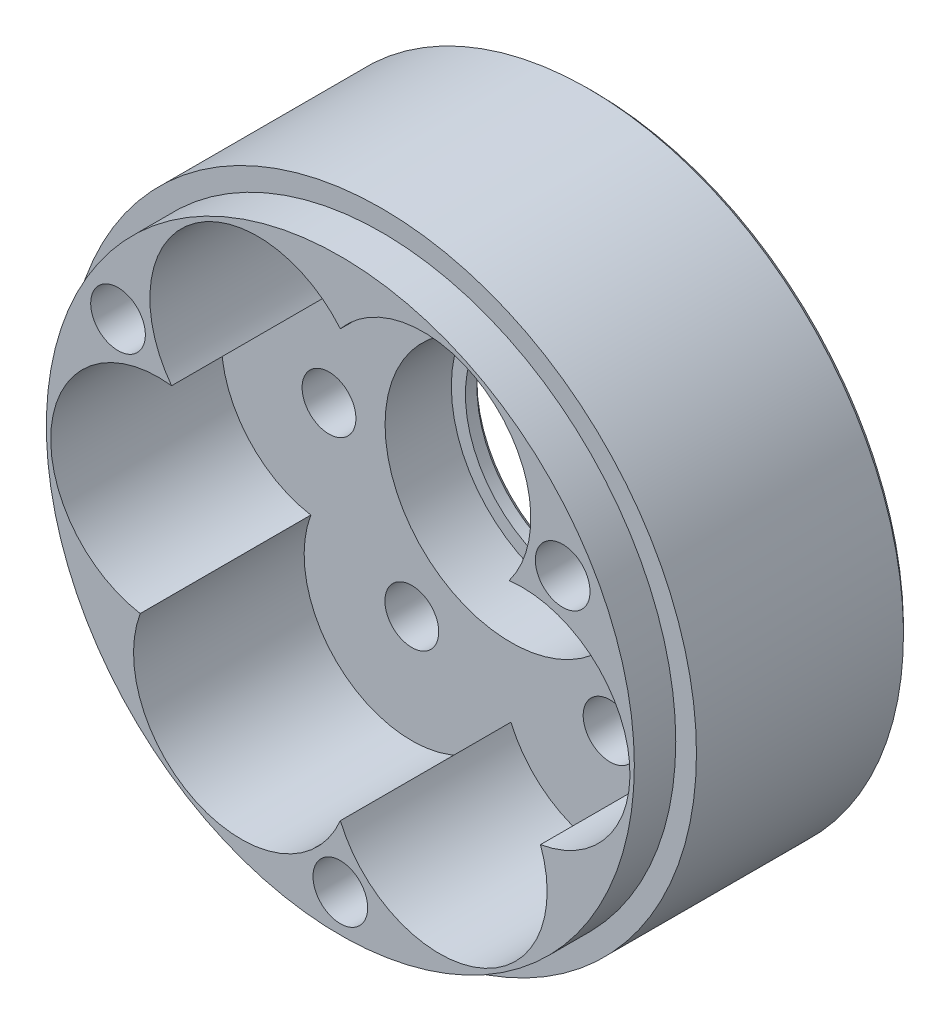
from build123d import *

# Parameters (mm, degrees)
BOSS_EXTRUDE1_OUTLINE_R   = 19
BOSS_EXTRUDE1_OUTLINE_R_2 = 1.65
BOSS_EXTRUDE1_DEPTH       = 10.8
BOSS_EXTRUDE2_START       = -5
SKETCH1_3_R               = 19
SKETCH1_3_R_2             = 1.625
SKETCH1_3_R_3             = 7.6
SKETCH1_3_R_4             = 1.65
BOSS_EXTRUDE2_DEPTH       = 5
BOSS_EXTRUDE3_START       = -5
SKETCH1_4_R               = 1.625
BOSS_EXTRUDE3_DEPTH       = 2
BOSS_EXTRUDE4_START       = -5
SKETCH1_5_R               = 7.6
SKETCH1_5_R_2             = 6.75
BOSS_EXTRUDE4_DEPTH       = 1
CUT_EXTRUDE9_START        = 7.8
SKETCH1_11_R              = 19
SKETCH1_11_R_2            = 18
SKETCH1_11_R_3            = 17.75
CUT_EXTRUDE9_DEPTH        = 3
CUT_EXTRUDE6_DEPTH        = 3.5
CUT_EXTRUDE10_START       = -0.5
SKETCH2_R                 = 17.75
CUT_EXTRUDE10_DEPTH       = 0.5
CHAMFER1_SIZE             = 0.3
CHAMFER2_SIZE             = 0.3
CUT_EXTRUDE12_START       = -3.4
SKETCH1_13_R              = 1.625
CUT_EXTRUDE12_DEPTH       = 0.4


# Read off the part's stored shape, not the designer's step: Boss-Extrude1
with BuildPart() as part:
    # Boss-Extrude1 outline → Boss-Extrude1 (new body)
    with BuildSketch(Plane.XY):
        Circle(BOSS_EXTRUDE1_OUTLINE_R)
        with Locations((0, -15.5)):
            Circle(BOSS_EXTRUDE1_OUTLINE_R_2, mode=Mode.SUBTRACT)
        with Locations((-13.423393759, 7.75)):
            Circle(BOSS_EXTRUDE1_OUTLINE_R_2, mode=Mode.SUBTRACT)
        with BuildLine():
            ThreePointArc((0, -11.764142376), (-8.38018489, -15.2718242), (-12.082155017, -6.975635451))
            ThreePointArc((-12.082155017, -6.975635451), (-17.415880165, 0.378459097), (-10.188046152, 5.882071188))
            ThreePointArc((-10.188046152, 5.882071188), (-9.035695274, 14.893365103), (0, 13.951270903))
            ThreePointArc((0, 13.951270903), (9.035695274, 14.893365103), (10.188046152, 5.882071188))
            ThreePointArc((10.188046152, 5.882071188), (17.415880165, 0.378459097), (12.082155017, -6.975635451))
            ThreePointArc((12.082155017, -6.975635451), (8.38018489, -15.2718242), (0, -11.764142376))
        make_face(mode=Mode.SUBTRACT)
        with Locations((13.423393759, 7.75)):
            Circle(BOSS_EXTRUDE1_OUTLINE_R_2, mode=Mode.SUBTRACT)
    extrude(amount=BOSS_EXTRUDE1_DEPTH)

    # Sketch1<3> → Boss-Extrude2 (add)
    with BuildSketch(Plane.XY.offset(BOSS_EXTRUDE2_START)):
        with Locations(Location((0, 0, 0), (0, 0, 180))):
            Circle(SKETCH1_3_R)
        with Locations((-10.985281374, -0.568852467)):
            Circle(SKETCH1_3_R_2, mode=Mode.SUBTRACT)
        with Locations((-5.985281374, -9.229106504)):
            Circle(SKETCH1_3_R_2, mode=Mode.SUBTRACT)
        with Locations((5.985281374, -9.229106504)):
            Circle(SKETCH1_3_R_2, mode=Mode.SUBTRACT)
        with Locations((10.985281374, -0.568852467)):
            Circle(SKETCH1_3_R_2, mode=Mode.SUBTRACT)
        with Locations((5, 9.797958971)):
            Circle(SKETCH1_3_R_2, mode=Mode.SUBTRACT)
        with Locations((-5, 9.797958971)):
            Circle(SKETCH1_3_R_2, mode=Mode.SUBTRACT)
        Circle(SKETCH1_3_R_3, mode=Mode.SUBTRACT)
        with Locations(Location((-13.423393759, 7.75, 0), (0, 0, 180))):
            Circle(SKETCH1_3_R_4, mode=Mode.SUBTRACT)
        with Locations(Location((13.423393759, 7.75, 0), (0, 0, 180))):
            Circle(SKETCH1_3_R_4, mode=Mode.SUBTRACT)
        with Locations(Location((0, -15.5, 0), (0, 0, 180))):
            Circle(SKETCH1_3_R_4, mode=Mode.SUBTRACT)
    extrude(amount=BOSS_EXTRUDE2_DEPTH)

    # Sketch1<4> → Boss-Extrude3 (add)
    with BuildSketch(Plane.XY.offset(BOSS_EXTRUDE3_START)):
        with Locations((-5, 9.797958971)):
            Circle(SKETCH1_4_R)
        with Locations((5, 9.797958971)):
            Circle(SKETCH1_4_R)
        with Locations((10.985281374, -0.568852467)):
            Circle(SKETCH1_4_R)
        with Locations((5.985281374, -9.229106504)):
            Circle(SKETCH1_4_R)
        with Locations((-5.985281374, -9.229106504)):
            Circle(SKETCH1_4_R)
        with Locations((-10.985281374, -0.568852467)):
            Circle(SKETCH1_4_R)
    extrude(amount=BOSS_EXTRUDE3_DEPTH)

    # Sketch1<5> → Boss-Extrude4 (add)
    with BuildSketch(Plane.XY.offset(BOSS_EXTRUDE4_START)):
        Circle(SKETCH1_5_R)
        Circle(SKETCH1_5_R_2, mode=Mode.SUBTRACT)
    extrude(amount=BOSS_EXTRUDE4_DEPTH)

    # Sketch1<11> → Cut-Extrude9 (cut)
    # profile 1 of 2: a face of its own
    with BuildSketch(Plane.XY.offset(CUT_EXTRUDE9_START)):
        with Locations(Location((0, 0, 0), (0, 0, 180))):
            Circle(SKETCH1_11_R)
        Circle(SKETCH1_11_R_2, mode=Mode.SUBTRACT)
    # profile 2 of 2: a face of its own
    with BuildSketch(Plane.XY.offset(CUT_EXTRUDE9_START)):
        Circle(SKETCH1_11_R_2)
        Circle(SKETCH1_11_R_3, mode=Mode.SUBTRACT)
    extrude(amount=CUT_EXTRUDE9_DEPTH, mode=Mode.SUBTRACT)

    # Sketch4 → Cut-Extrude6 (cut)
    with BuildSketch(Plane(origin=(0, 0, -5), x_dir=(-1, 0, 0), z_dir=(0, 0, -1))):
        Polygon((11.777945491, 4.9), (15.068842026, 4.9), (16.714290293, 7.75), (15.068842026, 10.6), (11.777945491, 10.6), (10.132497224, 7.75), align=None)
        Polygon((-1.645448267, -12.65), (-3.290896534, -15.5), (-1.645448267, -18.35), (1.645448267, -18.35), (3.290896534, -15.5), (1.645448267, -12.65), align=None)
        Polygon((-11.777945491, 4.9), (-10.132497224, 7.75), (-11.777945491, 10.6), (-15.068842026, 10.6), (-16.714290293, 7.75), (-15.068842026, 4.9), align=None)
    extrude(amount=-CUT_EXTRUDE6_DEPTH, mode=Mode.SUBTRACT)

    # Sketch2 → Cut-Extrude10 (cut)
    with BuildSketch(Plane.XY.offset(10.8).offset(CUT_EXTRUDE10_START)):
        Circle(SKETCH2_R)
    extrude(amount=CUT_EXTRUDE10_DEPTH, mode=Mode.SUBTRACT)

    # Chamfer1
    chamfer1_edges = [part.edges().sort_by_distance(p)[0] for p in [
        (19, 0, -5),
        (-6.75, 0, -5),
    ]]
    chamfer(chamfer1_edges, length=CHAMFER1_SIZE)

    # Chamfer2
    # the kernel refuses this chamfer: 0.3 mm, written as the material it takes off along each edge
    with BuildSketch(Plane(origin=(-9.746744776, 8.418142839, -5), x_dir=(0.8656979742248802, -0.49981095845564855, -0.02749587661058736), z_dir=(-0.5000000000000003, -0.8660254037844386, 0))) as chamfer2_piece_1_section:
        Polygon((CHAMFER2_SIZE * 0.999621916911, CHAMFER2_SIZE * 0.0274958766106), (-CHAMFER2_SIZE * 0.0274958766106, CHAMFER2_SIZE * 0.999621916911), (0, 0), align=None)
    chamfer2_piece_1 = extrude(amount=4.833906327, mode=Mode.PRIVATE)
    chamfer2_piece_1 = split(chamfer2_piece_1, bisect_by=Plane(origin=(-9.679193276, 6.964854531, -4.899951291), z_dir=(-0.8660254037844389, -0.4999999999999996, 0)), keep=Keep.TOP, mode=Mode.PRIVATE)
    chamfer2_piece_1 = split(chamfer2_piece_1, bisect_by=Plane(origin=(-10.871337596, 4.9, -4.899951291), z_dir=(0, 1, 0)), keep=Keep.TOP, mode=Mode.PRIVATE)
    add(chamfer2_piece_1, mode=Mode.SUBTRACT)
    with BuildSketch(Plane(origin=(-11.006440595, 4.9, -5), x_dir=(0, -0.9996219169112968, -0.027495876610587344), z_dir=(-1, 0, 0))) as chamfer2_piece_2_section:
        Polygon((CHAMFER2_SIZE * 0.999621916911, CHAMFER2_SIZE * 0.0274958766106), (-CHAMFER2_SIZE * 0.0274958766106, CHAMFER2_SIZE * 0.999621916911), (0, 0), align=None)
    chamfer2_piece_2 = extrude(amount=4.833906327, mode=Mode.PRIVATE)
    chamfer2_piece_2 = split(chamfer2_piece_2, bisect_by=Plane(origin=(-12.231249439, 4.114854531, -4.899951291), z_dir=(-0.8660254037844387, 0.5000000000000003, 0)), keep=Keep.TOP, mode=Mode.PRIVATE)
    chamfer2_piece_2 = split(chamfer2_piece_2, bisect_by=Plane(origin=(-14.615538078, 4.114854531, -4.899951291), z_dir=(0.8660254037844396, 0.4999999999999984, 0)), keep=Keep.TOP, mode=Mode.PRIVATE)
    add(chamfer2_piece_2, mode=Mode.SUBTRACT)
    with BuildSketch(Plane(origin=(-14.683089578, 4.231857161, -5), x_dir=(-0.8656979742248813, -0.49981095845564677, -0.027495876610587403), z_dir=(-0.4999999999999984, 0.8660254037844396, 0))) as chamfer2_piece_3_section:
        Polygon((CHAMFER2_SIZE * 0.999621916911, CHAMFER2_SIZE * 0.0274958766106), (-CHAMFER2_SIZE * 0.0274958766106, CHAMFER2_SIZE * 0.999621916911), (0, 0), align=None)
    chamfer2_piece_3 = extrude(amount=4.833906327, mode=Mode.PRIVATE)
    chamfer2_piece_3 = split(chamfer2_piece_3, bisect_by=Plane(origin=(-17.167594241, 6.964854531, -4.899951291), z_dir=(0.8660254037844386, -0.5000000000000001, 0)), keep=Keep.TOP, mode=Mode.PRIVATE)
    chamfer2_piece_3 = split(chamfer2_piece_3, bisect_by=Plane(origin=(-15.975449921, 4.9, -4.899951291), z_dir=(0, 1, 0)), keep=Keep.TOP, mode=Mode.PRIVATE)
    add(chamfer2_piece_3, mode=Mode.SUBTRACT)
    with BuildSketch(Plane(origin=(-17.100042741, 7.081857161, -5), x_dir=(-0.8656979742248804, 0.4998109584556485, -0.027495876610587368), z_dir=(0.5000000000000001, 0.8660254037844386, 0))) as chamfer2_piece_4_section:
        Polygon((CHAMFER2_SIZE * 0.999621916911, CHAMFER2_SIZE * 0.0274958766106), (-CHAMFER2_SIZE * 0.0274958766106, CHAMFER2_SIZE * 0.999621916911), (0, 0), align=None)
    chamfer2_piece_4 = extrude(amount=4.833906327, mode=Mode.PRIVATE)
    chamfer2_piece_4 = split(chamfer2_piece_4, bisect_by=Plane(origin=(-15.975449921, 10.6, -4.899951291), z_dir=(0, -1, 0)), keep=Keep.TOP, mode=Mode.PRIVATE)
    chamfer2_piece_4 = split(chamfer2_piece_4, bisect_by=Plane(origin=(-17.167594241, 8.535145469, -4.899951291), z_dir=(0.8660254037844396, 0.4999999999999984, 0)), keep=Keep.TOP, mode=Mode.PRIVATE)
    add(chamfer2_piece_4, mode=Mode.SUBTRACT)
    with BuildSketch(Plane(origin=(-15.840346922, 10.6, -5), x_dir=(0, 0.9996219169112968, -0.027495876610587344), z_dir=(1, 0, 0))) as chamfer2_piece_5_section:
        Polygon((CHAMFER2_SIZE * 0.999621916911, CHAMFER2_SIZE * 0.0274958766106), (-CHAMFER2_SIZE * 0.0274958766106, CHAMFER2_SIZE * 0.999621916911), (0, 0), align=None)
    chamfer2_piece_5 = extrude(amount=4.833906327, mode=Mode.PRIVATE)
    chamfer2_piece_5 = split(chamfer2_piece_5, bisect_by=Plane(origin=(-12.231249439, 11.385145469, -4.899951291), z_dir=(-0.8660254037844389, -0.4999999999999996, 0)), keep=Keep.TOP, mode=Mode.PRIVATE)
    chamfer2_piece_5 = split(chamfer2_piece_5, bisect_by=Plane(origin=(-14.615538078, 11.385145469, -4.899951291), z_dir=(0.8660254037844386, -0.5000000000000001, 0)), keep=Keep.TOP, mode=Mode.PRIVATE)
    add(chamfer2_piece_5, mode=Mode.SUBTRACT)
    with BuildSketch(Plane(origin=(-12.16369794, 11.268142839, -5), x_dir=(0.8656979742248805, 0.4998109584556478, -0.02749587661058736), z_dir=(0.4999999999999996, -0.8660254037844389, 0))) as chamfer2_piece_6_section:
        Polygon((CHAMFER2_SIZE * 0.999621916911, CHAMFER2_SIZE * 0.0274958766106), (-CHAMFER2_SIZE * 0.0274958766106, CHAMFER2_SIZE * 0.999621916911), (0, 0), align=None)
    chamfer2_piece_6 = extrude(amount=4.833906327, mode=Mode.PRIVATE)
    chamfer2_piece_6 = split(chamfer2_piece_6, bisect_by=Plane(origin=(-9.679193276, 8.535145469, -4.899951291), z_dir=(-0.8660254037844387, 0.5000000000000003, 0)), keep=Keep.TOP, mode=Mode.PRIVATE)
    chamfer2_piece_6 = split(chamfer2_piece_6, bisect_by=Plane(origin=(-10.871337596, 10.6, -4.899951291), z_dir=(0, -1, 0)), keep=Keep.TOP, mode=Mode.PRIVATE)
    add(chamfer2_piece_6, mode=Mode.SUBTRACT)
    with BuildSketch(Plane(origin=(-2.416953164, -12.65, -5), x_dir=(0, 0.9996219169112968, -0.027495876610587344), z_dir=(1, 0, 0))) as chamfer2_piece_7_section:
        Polygon((CHAMFER2_SIZE * 0.999621916911, CHAMFER2_SIZE * 0.0274958766106), (-CHAMFER2_SIZE * 0.0274958766106, CHAMFER2_SIZE * 0.999621916911), (0, 0), align=None)
    chamfer2_piece_7 = extrude(amount=4.833906327, mode=Mode.PRIVATE)
    chamfer2_piece_7 = split(chamfer2_piece_7, bisect_by=Plane(origin=(-1.192144319, -11.864854531, -4.899951291), z_dir=(0.8660254037844389, -0.4999999999999995, 0)), keep=Keep.TOP, mode=Mode.PRIVATE)
    chamfer2_piece_7 = split(chamfer2_piece_7, bisect_by=Plane(origin=(1.192144319, -11.864854531, -4.899951291), z_dir=(-0.8660254037844385, -0.5000000000000003, 0)), keep=Keep.TOP, mode=Mode.PRIVATE)
    add(chamfer2_piece_7, mode=Mode.SUBTRACT)
    with BuildSketch(Plane(origin=(1.259695819, -11.981857161, -5), x_dir=(0.8656979742248802, 0.4998109584556487, -0.027495876610587368), z_dir=(0.5000000000000003, -0.8660254037844385, 0))) as chamfer2_piece_8_section:
        Polygon((CHAMFER2_SIZE * 0.999621916911, CHAMFER2_SIZE * 0.0274958766106), (-CHAMFER2_SIZE * 0.0274958766106, CHAMFER2_SIZE * 0.999621916911), (0, 0), align=None)
    chamfer2_piece_8 = extrude(amount=4.833906327, mode=Mode.PRIVATE)
    chamfer2_piece_8 = split(chamfer2_piece_8, bisect_by=Plane(origin=(2.552056163, -12.65, -4.899951291), z_dir=(0, -1, 0)), keep=Keep.TOP, mode=Mode.PRIVATE)
    chamfer2_piece_8 = split(chamfer2_piece_8, bisect_by=Plane(origin=(3.744200482, -14.714854531, -4.899951291), z_dir=(-0.8660254037844387, 0.5000000000000003, 0)), keep=Keep.TOP, mode=Mode.PRIVATE)
    add(chamfer2_piece_8, mode=Mode.SUBTRACT)
    with BuildSketch(Plane(origin=(3.676648983, -14.831857161, -5), x_dir=(0.8656979742248802, -0.49981095845564855, -0.02749587661058736), z_dir=(-0.5000000000000003, -0.8660254037844386, 0))) as chamfer2_piece_9_section:
        Polygon((CHAMFER2_SIZE * 0.999621916911, CHAMFER2_SIZE * 0.0274958766106), (-CHAMFER2_SIZE * 0.0274958766106, CHAMFER2_SIZE * 0.999621916911), (0, 0), align=None)
    chamfer2_piece_9 = extrude(amount=4.833906327, mode=Mode.PRIVATE)
    chamfer2_piece_9 = split(chamfer2_piece_9, bisect_by=Plane(origin=(2.552056163, -18.35, -4.899951291), z_dir=(0, 1, 0)), keep=Keep.TOP, mode=Mode.PRIVATE)
    chamfer2_piece_9 = split(chamfer2_piece_9, bisect_by=Plane(origin=(3.744200482, -16.285145469, -4.899951291), z_dir=(-0.8660254037844385, -0.5000000000000003, 0)), keep=Keep.TOP, mode=Mode.PRIVATE)
    add(chamfer2_piece_9, mode=Mode.SUBTRACT)
    with BuildSketch(Plane(origin=(2.416953164, -18.35, -5), x_dir=(0, -0.9996219169112968, -0.027495876610587344), z_dir=(-1, 0, 0))) as chamfer2_piece_10_section:
        Polygon((CHAMFER2_SIZE * 0.999621916911, CHAMFER2_SIZE * 0.0274958766106), (-CHAMFER2_SIZE * 0.0274958766106, CHAMFER2_SIZE * 0.999621916911), (0, 0), align=None)
    chamfer2_piece_10 = extrude(amount=4.833906327, mode=Mode.PRIVATE)
    chamfer2_piece_10 = split(chamfer2_piece_10, bisect_by=Plane(origin=(-1.192144319, -19.135145469, -4.899951291), z_dir=(0.8660254037844385, 0.5000000000000004, 0)), keep=Keep.TOP, mode=Mode.PRIVATE)
    chamfer2_piece_10 = split(chamfer2_piece_10, bisect_by=Plane(origin=(1.192144319, -19.135145469, -4.899951291), z_dir=(-0.8660254037844387, 0.5000000000000003, 0)), keep=Keep.TOP, mode=Mode.PRIVATE)
    add(chamfer2_piece_10, mode=Mode.SUBTRACT)
    with BuildSketch(Plane(origin=(-1.259695819, -19.018142839, -5), x_dir=(-0.86569797422488, -0.4998109584556487, -0.027495876610587347), z_dir=(-0.5000000000000004, 0.8660254037844385, 0))) as chamfer2_piece_11_section:
        Polygon((CHAMFER2_SIZE * 0.999621916911, CHAMFER2_SIZE * 0.0274958766106), (-CHAMFER2_SIZE * 0.0274958766106, CHAMFER2_SIZE * 0.999621916911), (0, 0), align=None)
    chamfer2_piece_11 = extrude(amount=4.833906327, mode=Mode.PRIVATE)
    chamfer2_piece_11 = split(chamfer2_piece_11, bisect_by=Plane(origin=(-3.744200482, -16.285145469, -4.899951291), z_dir=(0.8660254037844389, -0.4999999999999995, 0)), keep=Keep.TOP, mode=Mode.PRIVATE)
    chamfer2_piece_11 = split(chamfer2_piece_11, bisect_by=Plane(origin=(-2.552056163, -18.35, -4.899951291), z_dir=(0, 1, 0)), keep=Keep.TOP, mode=Mode.PRIVATE)
    add(chamfer2_piece_11, mode=Mode.SUBTRACT)
    with BuildSketch(Plane(origin=(-3.676648983, -16.168142839, -5), x_dir=(-0.8656979742248805, 0.4998109584556478, -0.02749587661058736), z_dir=(0.4999999999999995, 0.8660254037844389, 0))) as chamfer2_piece_12_section:
        Polygon((CHAMFER2_SIZE * 0.999621916911, CHAMFER2_SIZE * 0.0274958766106), (-CHAMFER2_SIZE * 0.0274958766106, CHAMFER2_SIZE * 0.999621916911), (0, 0), align=None)
    chamfer2_piece_12 = extrude(amount=4.833906327, mode=Mode.PRIVATE)
    chamfer2_piece_12 = split(chamfer2_piece_12, bisect_by=Plane(origin=(-2.552056163, -12.65, -4.899951291), z_dir=(0, -1, 0)), keep=Keep.TOP, mode=Mode.PRIVATE)
    chamfer2_piece_12 = split(chamfer2_piece_12, bisect_by=Plane(origin=(-3.744200482, -14.714854531, -4.899951291), z_dir=(0.8660254037844385, 0.5000000000000004, 0)), keep=Keep.TOP, mode=Mode.PRIVATE)
    add(chamfer2_piece_12, mode=Mode.SUBTRACT)
    with BuildSketch(Plane(origin=(15.840346922, 4.9, -5), x_dir=(0, -0.9996219169112968, -0.027495876610587344), z_dir=(-1, 0, 0))) as chamfer2_piece_13_section:
        Polygon((CHAMFER2_SIZE * 0.999621916911, CHAMFER2_SIZE * 0.0274958766106), (-CHAMFER2_SIZE * 0.0274958766106, CHAMFER2_SIZE * 0.999621916911), (0, 0), align=None)
    chamfer2_piece_13 = extrude(amount=4.833906327, mode=Mode.PRIVATE)
    chamfer2_piece_13 = split(chamfer2_piece_13, bisect_by=Plane(origin=(14.615538078, 4.114854531, -4.899951291), z_dir=(-0.8660254037844389, 0.4999999999999995, 0)), keep=Keep.TOP, mode=Mode.PRIVATE)
    chamfer2_piece_13 = split(chamfer2_piece_13, bisect_by=Plane(origin=(12.231249439, 4.114854531, -4.899951291), z_dir=(0.8660254037844386, 0.5000000000000001, 0)), keep=Keep.TOP, mode=Mode.PRIVATE)
    add(chamfer2_piece_13, mode=Mode.SUBTRACT)
    with BuildSketch(Plane(origin=(12.16369794, 4.231857161, -5), x_dir=(-0.8656979742248804, -0.4998109584556485, -0.027495876610587368), z_dir=(-0.5000000000000001, 0.8660254037844386, 0))) as chamfer2_piece_14_section:
        Polygon((CHAMFER2_SIZE * 0.999621916911, CHAMFER2_SIZE * 0.0274958766106), (-CHAMFER2_SIZE * 0.0274958766106, CHAMFER2_SIZE * 0.999621916911), (0, 0), align=None)
    chamfer2_piece_14 = extrude(amount=4.833906327, mode=Mode.PRIVATE)
    chamfer2_piece_14 = split(chamfer2_piece_14, bisect_by=Plane(origin=(10.871337596, 4.9, -4.899951291), z_dir=(0, 1, 0)), keep=Keep.TOP, mode=Mode.PRIVATE)
    chamfer2_piece_14 = split(chamfer2_piece_14, bisect_by=Plane(origin=(9.679193276, 6.964854531, -4.899951291), z_dir=(0.8660254037844388, -0.49999999999999967, 0)), keep=Keep.TOP, mode=Mode.PRIVATE)
    add(chamfer2_piece_14, mode=Mode.SUBTRACT)
    with BuildSketch(Plane(origin=(9.746744776, 7.081857161, -5), x_dir=(-0.8656979742248805, 0.4998109584556481, -0.027495876610587406), z_dir=(0.49999999999999967, 0.8660254037844388, 0))) as chamfer2_piece_15_section:
        Polygon((CHAMFER2_SIZE * 0.999621916911, CHAMFER2_SIZE * 0.0274958766106), (-CHAMFER2_SIZE * 0.0274958766106, CHAMFER2_SIZE * 0.999621916911), (0, 0), align=None)
    chamfer2_piece_15 = extrude(amount=4.833906327, mode=Mode.PRIVATE)
    chamfer2_piece_15 = split(chamfer2_piece_15, bisect_by=Plane(origin=(10.871337596, 10.6, -4.899951291), z_dir=(0, -1, 0)), keep=Keep.TOP, mode=Mode.PRIVATE)
    chamfer2_piece_15 = split(chamfer2_piece_15, bisect_by=Plane(origin=(9.679193276, 8.535145469, -4.899951291), z_dir=(0.8660254037844386, 0.5000000000000001, 0)), keep=Keep.TOP, mode=Mode.PRIVATE)
    add(chamfer2_piece_15, mode=Mode.SUBTRACT)
    with BuildSketch(Plane(origin=(11.006440595, 10.6, -5), x_dir=(0, 0.9996219169112968, -0.027495876610587344), z_dir=(1, 0, 0))) as chamfer2_piece_16_section:
        Polygon((CHAMFER2_SIZE * 0.999621916911, CHAMFER2_SIZE * 0.0274958766106), (-CHAMFER2_SIZE * 0.0274958766106, CHAMFER2_SIZE * 0.999621916911), (0, 0), align=None)
    chamfer2_piece_16 = extrude(amount=4.833906327, mode=Mode.PRIVATE)
    chamfer2_piece_16 = split(chamfer2_piece_16, bisect_by=Plane(origin=(14.615538078, 11.385145469, -4.899951291), z_dir=(-0.8660254037844388, -0.4999999999999999, 0)), keep=Keep.TOP, mode=Mode.PRIVATE)
    chamfer2_piece_16 = split(chamfer2_piece_16, bisect_by=Plane(origin=(12.231249439, 11.385145469, -4.899951291), z_dir=(0.8660254037844388, -0.49999999999999967, 0)), keep=Keep.TOP, mode=Mode.PRIVATE)
    add(chamfer2_piece_16, mode=Mode.SUBTRACT)
    with BuildSketch(Plane(origin=(14.683089578, 11.268142839, -5), x_dir=(0.8656979742248804, 0.4998109584556482, -0.02749587661058736), z_dir=(0.4999999999999999, -0.8660254037844388, 0))) as chamfer2_piece_17_section:
        Polygon((CHAMFER2_SIZE * 0.999621916911, CHAMFER2_SIZE * 0.0274958766106), (-CHAMFER2_SIZE * 0.0274958766106, CHAMFER2_SIZE * 0.999621916911), (0, 0), align=None)
    chamfer2_piece_17 = extrude(amount=4.833906327, mode=Mode.PRIVATE)
    chamfer2_piece_17 = split(chamfer2_piece_17, bisect_by=Plane(origin=(17.167594241, 8.535145469, -4.899951291), z_dir=(-0.8660254037844389, 0.4999999999999995, 0)), keep=Keep.TOP, mode=Mode.PRIVATE)
    chamfer2_piece_17 = split(chamfer2_piece_17, bisect_by=Plane(origin=(15.975449921, 10.6, -4.899951291), z_dir=(0, -1, 0)), keep=Keep.TOP, mode=Mode.PRIVATE)
    add(chamfer2_piece_17, mode=Mode.SUBTRACT)
    with BuildSketch(Plane(origin=(17.100042741, 8.418142839, -5), x_dir=(0.8656979742248805, -0.4998109584556478, -0.02749587661058736), z_dir=(-0.4999999999999995, -0.8660254037844389, 0))) as chamfer2_piece_18_section:
        Polygon((CHAMFER2_SIZE * 0.999621916911, CHAMFER2_SIZE * 0.0274958766106), (-CHAMFER2_SIZE * 0.0274958766106, CHAMFER2_SIZE * 0.999621916911), (0, 0), align=None)
    chamfer2_piece_18 = extrude(amount=4.833906327, mode=Mode.PRIVATE)
    chamfer2_piece_18 = split(chamfer2_piece_18, bisect_by=Plane(origin=(15.975449921, 4.9, -4.899951291), z_dir=(0, 1, 0)), keep=Keep.TOP, mode=Mode.PRIVATE)
    chamfer2_piece_18 = split(chamfer2_piece_18, bisect_by=Plane(origin=(17.167594241, 6.964854531, -4.899951291), z_dir=(-0.8660254037844388, -0.4999999999999999, 0)), keep=Keep.TOP, mode=Mode.PRIVATE)
    add(chamfer2_piece_18, mode=Mode.SUBTRACT)
    with BuildSketch(Plane(origin=(-9.746744776, 8.418142839, -5), x_dir=(0.8656979742248802, -0.49981095845564855, -0.02749587661058736), z_dir=(-0.5000000000000003, -0.8660254037844386, 0))) as chamfer2_piece_19a_section:
        Polygon((CHAMFER2_SIZE * 0.999621916911, CHAMFER2_SIZE * 0.0274958766106), (-CHAMFER2_SIZE * 0.0274958766106, CHAMFER2_SIZE * 0.999621916911), (0, 0), align=None)
    chamfer2_piece_19a = extrude(amount=4.833906327, mode=Mode.PRIVATE)
    chamfer2_piece_19a = split(chamfer2_piece_19a, bisect_by=Plane(origin=(-10.176941954, 7.82698053, -4.903190769), z_dir=(0.8660254037844389, 0.4999999999999996, 0)), keep=Keep.TOP, mode=Mode.PRIVATE)
    with BuildSketch(Plane(origin=(-12.16369794, 11.268142839, -5), x_dir=(0.8656979742248805, 0.4998109584556478, -0.02749587661058736), z_dir=(0.4999999999999996, -0.8660254037844389, 0))) as chamfer2_piece_19b_section:
        Polygon((CHAMFER2_SIZE * 0.999621916911, CHAMFER2_SIZE * 0.0274958766106), (-CHAMFER2_SIZE * 0.0274958766106, CHAMFER2_SIZE * 0.999621916911), (0, 0), align=None)
    chamfer2_piece_19b = extrude(amount=4.833906327, mode=Mode.PRIVATE)
    chamfer2_piece_19b = split(chamfer2_piece_19b, bisect_by=Plane(origin=(-10.176941954, 7.67301947, -4.903190769), z_dir=(0.8660254037844387, -0.5000000000000003, 0)), keep=Keep.TOP, mode=Mode.PRIVATE)
    chamfer2_piece_19 = chamfer2_piece_19a & chamfer2_piece_19b
    add(chamfer2_piece_19, mode=Mode.SUBTRACT)
    with BuildSketch(Plane(origin=(-9.746744776, 8.418142839, -5), x_dir=(0.8656979742248802, -0.49981095845564855, -0.02749587661058736), z_dir=(-0.5000000000000003, -0.8660254037844386, 0))) as chamfer2_piece_20a_section:
        Polygon((CHAMFER2_SIZE * 0.999621916911, CHAMFER2_SIZE * 0.0274958766106), (-CHAMFER2_SIZE * 0.0274958766106, CHAMFER2_SIZE * 0.999621916911), (0, 0), align=None)
    chamfer2_piece_20a = extrude(amount=4.833906327, mode=Mode.PRIVATE)
    chamfer2_piece_20a = split(chamfer2_piece_20a, bisect_by=Plane(origin=(-11.866834951, 4.9, -4.903190769), z_dir=(0, -1, 0)), keep=Keep.TOP, mode=Mode.PRIVATE)
    with BuildSketch(Plane(origin=(-11.006440595, 4.9, -5), x_dir=(0, -0.9996219169112968, -0.027495876610587344), z_dir=(-1, 0, 0))) as chamfer2_piece_20b_section:
        Polygon((CHAMFER2_SIZE * 0.999621916911, CHAMFER2_SIZE * 0.0274958766106), (-CHAMFER2_SIZE * 0.0274958766106, CHAMFER2_SIZE * 0.999621916911), (0, 0), align=None)
    chamfer2_piece_20b = extrude(amount=4.833906327, mode=Mode.PRIVATE)
    chamfer2_piece_20b = split(chamfer2_piece_20b, bisect_by=Plane(origin=(-11.733500761, 4.97698053, -4.903190769), z_dir=(0.8660254037844387, -0.5000000000000003, 0)), keep=Keep.TOP, mode=Mode.PRIVATE)
    chamfer2_piece_20 = chamfer2_piece_20a & chamfer2_piece_20b
    add(chamfer2_piece_20, mode=Mode.SUBTRACT)
    with BuildSketch(Plane(origin=(-14.683089578, 4.231857161, -5), x_dir=(-0.8656979742248813, -0.49981095845564677, -0.027495876610587403), z_dir=(-0.4999999999999984, 0.8660254037844396, 0))) as chamfer2_piece_21a_section:
        Polygon((CHAMFER2_SIZE * 0.999621916911, CHAMFER2_SIZE * 0.0274958766106), (-CHAMFER2_SIZE * 0.0274958766106, CHAMFER2_SIZE * 0.999621916911), (0, 0), align=None)
    chamfer2_piece_21a = extrude(amount=4.833906327, mode=Mode.PRIVATE)
    chamfer2_piece_21a = split(chamfer2_piece_21a, bisect_by=Plane(origin=(-14.979952566, 4.9, -4.903190769), z_dir=(0, -1, 0)), keep=Keep.TOP, mode=Mode.PRIVATE)
    with BuildSketch(Plane(origin=(-11.006440595, 4.9, -5), x_dir=(0, -0.9996219169112968, -0.027495876610587344), z_dir=(-1, 0, 0))) as chamfer2_piece_21b_section:
        Polygon((CHAMFER2_SIZE * 0.999621916911, CHAMFER2_SIZE * 0.0274958766106), (-CHAMFER2_SIZE * 0.0274958766106, CHAMFER2_SIZE * 0.999621916911), (0, 0), align=None)
    chamfer2_piece_21b = extrude(amount=4.833906327, mode=Mode.PRIVATE)
    chamfer2_piece_21b = split(chamfer2_piece_21b, bisect_by=Plane(origin=(-15.113286756, 4.97698053, -4.903190769), z_dir=(-0.8660254037844396, -0.4999999999999984, 0)), keep=Keep.TOP, mode=Mode.PRIVATE)
    chamfer2_piece_21 = chamfer2_piece_21a & chamfer2_piece_21b
    add(chamfer2_piece_21, mode=Mode.SUBTRACT)
    with BuildSketch(Plane(origin=(-17.100042741, 7.081857161, -5), x_dir=(-0.8656979742248804, 0.4998109584556485, -0.027495876610587368), z_dir=(0.5000000000000001, 0.8660254037844386, 0))) as chamfer2_piece_22a_section:
        Polygon((CHAMFER2_SIZE * 0.999621916911, CHAMFER2_SIZE * 0.0274958766106), (-CHAMFER2_SIZE * 0.0274958766106, CHAMFER2_SIZE * 0.999621916911), (0, 0), align=None)
    chamfer2_piece_22a = extrude(amount=4.833906327, mode=Mode.PRIVATE)
    chamfer2_piece_22a = split(chamfer2_piece_22a, bisect_by=Plane(origin=(-16.669845563, 7.67301947, -4.903190769), z_dir=(-0.8660254037844396, -0.4999999999999984, 0)), keep=Keep.TOP, mode=Mode.PRIVATE)
    with BuildSketch(Plane(origin=(-14.683089578, 4.231857161, -5), x_dir=(-0.8656979742248813, -0.49981095845564677, -0.027495876610587403), z_dir=(-0.4999999999999984, 0.8660254037844396, 0))) as chamfer2_piece_22b_section:
        Polygon((CHAMFER2_SIZE * 0.999621916911, CHAMFER2_SIZE * 0.0274958766106), (-CHAMFER2_SIZE * 0.0274958766106, CHAMFER2_SIZE * 0.999621916911), (0, 0), align=None)
    chamfer2_piece_22b = extrude(amount=4.833906327, mode=Mode.PRIVATE)
    chamfer2_piece_22b = split(chamfer2_piece_22b, bisect_by=Plane(origin=(-16.669845563, 7.82698053, -4.903190769), z_dir=(-0.8660254037844386, 0.5000000000000001, 0)), keep=Keep.TOP, mode=Mode.PRIVATE)
    chamfer2_piece_22 = chamfer2_piece_22a & chamfer2_piece_22b
    add(chamfer2_piece_22, mode=Mode.SUBTRACT)
    with BuildSketch(Plane(origin=(-15.840346922, 10.6, -5), x_dir=(0, 0.9996219169112968, -0.027495876610587344), z_dir=(1, 0, 0))) as chamfer2_piece_23a_section:
        Polygon((CHAMFER2_SIZE * 0.999621916911, CHAMFER2_SIZE * 0.0274958766106), (-CHAMFER2_SIZE * 0.0274958766106, CHAMFER2_SIZE * 0.999621916911), (0, 0), align=None)
    chamfer2_piece_23a = extrude(amount=4.833906327, mode=Mode.PRIVATE)
    chamfer2_piece_23a = split(chamfer2_piece_23a, bisect_by=Plane(origin=(-15.113286756, 10.52301947, -4.903190769), z_dir=(-0.8660254037844386, 0.5000000000000001, 0)), keep=Keep.TOP, mode=Mode.PRIVATE)
    with BuildSketch(Plane(origin=(-17.100042741, 7.081857161, -5), x_dir=(-0.8656979742248804, 0.4998109584556485, -0.027495876610587368), z_dir=(0.5000000000000001, 0.8660254037844386, 0))) as chamfer2_piece_23b_section:
        Polygon((CHAMFER2_SIZE * 0.999621916911, CHAMFER2_SIZE * 0.0274958766106), (-CHAMFER2_SIZE * 0.0274958766106, CHAMFER2_SIZE * 0.999621916911), (0, 0), align=None)
    chamfer2_piece_23b = extrude(amount=4.833906327, mode=Mode.PRIVATE)
    chamfer2_piece_23b = split(chamfer2_piece_23b, bisect_by=Plane(origin=(-14.979952566, 10.6, -4.903190769), z_dir=(0, 1, 0)), keep=Keep.TOP, mode=Mode.PRIVATE)
    chamfer2_piece_23 = chamfer2_piece_23a & chamfer2_piece_23b
    add(chamfer2_piece_23, mode=Mode.SUBTRACT)
    with BuildSketch(Plane(origin=(-12.16369794, 11.268142839, -5), x_dir=(0.8656979742248805, 0.4998109584556478, -0.02749587661058736), z_dir=(0.4999999999999996, -0.8660254037844389, 0))) as chamfer2_piece_24a_section:
        Polygon((CHAMFER2_SIZE * 0.999621916911, CHAMFER2_SIZE * 0.0274958766106), (-CHAMFER2_SIZE * 0.0274958766106, CHAMFER2_SIZE * 0.999621916911), (0, 0), align=None)
    chamfer2_piece_24a = extrude(amount=4.833906327, mode=Mode.PRIVATE)
    chamfer2_piece_24a = split(chamfer2_piece_24a, bisect_by=Plane(origin=(-11.866834951, 10.6, -4.903190769), z_dir=(0, 1, 0)), keep=Keep.TOP, mode=Mode.PRIVATE)
    with BuildSketch(Plane(origin=(-15.840346922, 10.6, -5), x_dir=(0, 0.9996219169112968, -0.027495876610587344), z_dir=(1, 0, 0))) as chamfer2_piece_24b_section:
        Polygon((CHAMFER2_SIZE * 0.999621916911, CHAMFER2_SIZE * 0.0274958766106), (-CHAMFER2_SIZE * 0.0274958766106, CHAMFER2_SIZE * 0.999621916911), (0, 0), align=None)
    chamfer2_piece_24b = extrude(amount=4.833906327, mode=Mode.PRIVATE)
    chamfer2_piece_24b = split(chamfer2_piece_24b, bisect_by=Plane(origin=(-11.733500761, 10.52301947, -4.903190769), z_dir=(0.8660254037844389, 0.4999999999999996, 0)), keep=Keep.TOP, mode=Mode.PRIVATE)
    chamfer2_piece_24 = chamfer2_piece_24a & chamfer2_piece_24b
    add(chamfer2_piece_24, mode=Mode.SUBTRACT)
    with BuildSketch(Plane(origin=(-2.416953164, -12.65, -5), x_dir=(0, 0.9996219169112968, -0.027495876610587344), z_dir=(1, 0, 0))) as chamfer2_piece_25a_section:
        Polygon((CHAMFER2_SIZE * 0.999621916911, CHAMFER2_SIZE * 0.0274958766106), (-CHAMFER2_SIZE * 0.0274958766106, CHAMFER2_SIZE * 0.999621916911), (0, 0), align=None)
    chamfer2_piece_25a = extrude(amount=4.833906327, mode=Mode.PRIVATE)
    chamfer2_piece_25a = split(chamfer2_piece_25a, bisect_by=Plane(origin=(-1.689892997, -12.72698053, -4.903190769), z_dir=(-0.8660254037844389, 0.4999999999999995, 0)), keep=Keep.TOP, mode=Mode.PRIVATE)
    with BuildSketch(Plane(origin=(-3.676648983, -16.168142839, -5), x_dir=(-0.8656979742248805, 0.4998109584556478, -0.02749587661058736), z_dir=(0.4999999999999995, 0.8660254037844389, 0))) as chamfer2_piece_25b_section:
        Polygon((CHAMFER2_SIZE * 0.999621916911, CHAMFER2_SIZE * 0.0274958766106), (-CHAMFER2_SIZE * 0.0274958766106, CHAMFER2_SIZE * 0.999621916911), (0, 0), align=None)
    chamfer2_piece_25b = extrude(amount=4.833906327, mode=Mode.PRIVATE)
    chamfer2_piece_25b = split(chamfer2_piece_25b, bisect_by=Plane(origin=(-1.556558807, -12.65, -4.903190769), z_dir=(0, 1, 0)), keep=Keep.TOP, mode=Mode.PRIVATE)
    chamfer2_piece_25 = chamfer2_piece_25a & chamfer2_piece_25b
    add(chamfer2_piece_25, mode=Mode.SUBTRACT)
    with BuildSketch(Plane(origin=(-2.416953164, -12.65, -5), x_dir=(0, 0.9996219169112968, -0.027495876610587344), z_dir=(1, 0, 0))) as chamfer2_piece_26a_section:
        Polygon((CHAMFER2_SIZE * 0.999621916911, CHAMFER2_SIZE * 0.0274958766106), (-CHAMFER2_SIZE * 0.0274958766106, CHAMFER2_SIZE * 0.999621916911), (0, 0), align=None)
    chamfer2_piece_26a = extrude(amount=4.833906327, mode=Mode.PRIVATE)
    chamfer2_piece_26a = split(chamfer2_piece_26a, bisect_by=Plane(origin=(1.689892997, -12.72698053, -4.903190769), z_dir=(0.8660254037844385, 0.5000000000000003, 0)), keep=Keep.TOP, mode=Mode.PRIVATE)
    with BuildSketch(Plane(origin=(1.259695819, -11.981857161, -5), x_dir=(0.8656979742248802, 0.4998109584556487, -0.027495876610587368), z_dir=(0.5000000000000003, -0.8660254037844385, 0))) as chamfer2_piece_26b_section:
        Polygon((CHAMFER2_SIZE * 0.999621916911, CHAMFER2_SIZE * 0.0274958766106), (-CHAMFER2_SIZE * 0.0274958766106, CHAMFER2_SIZE * 0.999621916911), (0, 0), align=None)
    chamfer2_piece_26b = extrude(amount=4.833906327, mode=Mode.PRIVATE)
    chamfer2_piece_26b = split(chamfer2_piece_26b, bisect_by=Plane(origin=(1.556558807, -12.65, -4.903190769), z_dir=(0, 1, 0)), keep=Keep.TOP, mode=Mode.PRIVATE)
    chamfer2_piece_26 = chamfer2_piece_26a & chamfer2_piece_26b
    add(chamfer2_piece_26, mode=Mode.SUBTRACT)
    with BuildSketch(Plane(origin=(3.676648983, -14.831857161, -5), x_dir=(0.8656979742248802, -0.49981095845564855, -0.02749587661058736), z_dir=(-0.5000000000000003, -0.8660254037844386, 0))) as chamfer2_piece_27a_section:
        Polygon((CHAMFER2_SIZE * 0.999621916911, CHAMFER2_SIZE * 0.0274958766106), (-CHAMFER2_SIZE * 0.0274958766106, CHAMFER2_SIZE * 0.999621916911), (0, 0), align=None)
    chamfer2_piece_27a = extrude(amount=4.833906327, mode=Mode.PRIVATE)
    chamfer2_piece_27a = split(chamfer2_piece_27a, bisect_by=Plane(origin=(3.246451804, -15.42301947, -4.903190769), z_dir=(0.8660254037844385, 0.5000000000000003, 0)), keep=Keep.TOP, mode=Mode.PRIVATE)
    with BuildSketch(Plane(origin=(1.259695819, -11.981857161, -5), x_dir=(0.8656979742248802, 0.4998109584556487, -0.027495876610587368), z_dir=(0.5000000000000003, -0.8660254037844385, 0))) as chamfer2_piece_27b_section:
        Polygon((CHAMFER2_SIZE * 0.999621916911, CHAMFER2_SIZE * 0.0274958766106), (-CHAMFER2_SIZE * 0.0274958766106, CHAMFER2_SIZE * 0.999621916911), (0, 0), align=None)
    chamfer2_piece_27b = extrude(amount=4.833906327, mode=Mode.PRIVATE)
    chamfer2_piece_27b = split(chamfer2_piece_27b, bisect_by=Plane(origin=(3.246451804, -15.57698053, -4.903190769), z_dir=(0.8660254037844387, -0.5000000000000003, 0)), keep=Keep.TOP, mode=Mode.PRIVATE)
    chamfer2_piece_27 = chamfer2_piece_27a & chamfer2_piece_27b
    add(chamfer2_piece_27, mode=Mode.SUBTRACT)
    with BuildSketch(Plane(origin=(2.416953164, -18.35, -5), x_dir=(0, -0.9996219169112968, -0.027495876610587344), z_dir=(-1, 0, 0))) as chamfer2_piece_28a_section:
        Polygon((CHAMFER2_SIZE * 0.999621916911, CHAMFER2_SIZE * 0.0274958766106), (-CHAMFER2_SIZE * 0.0274958766106, CHAMFER2_SIZE * 0.999621916911), (0, 0), align=None)
    chamfer2_piece_28a = extrude(amount=4.833906327, mode=Mode.PRIVATE)
    chamfer2_piece_28a = split(chamfer2_piece_28a, bisect_by=Plane(origin=(1.689892997, -18.27301947, -4.903190769), z_dir=(0.8660254037844387, -0.5000000000000003, 0)), keep=Keep.TOP, mode=Mode.PRIVATE)
    with BuildSketch(Plane(origin=(3.676648983, -14.831857161, -5), x_dir=(0.8656979742248802, -0.49981095845564855, -0.02749587661058736), z_dir=(-0.5000000000000003, -0.8660254037844386, 0))) as chamfer2_piece_28b_section:
        Polygon((CHAMFER2_SIZE * 0.999621916911, CHAMFER2_SIZE * 0.0274958766106), (-CHAMFER2_SIZE * 0.0274958766106, CHAMFER2_SIZE * 0.999621916911), (0, 0), align=None)
    chamfer2_piece_28b = extrude(amount=4.833906327, mode=Mode.PRIVATE)
    chamfer2_piece_28b = split(chamfer2_piece_28b, bisect_by=Plane(origin=(1.556558807, -18.35, -4.903190769), z_dir=(0, -1, 0)), keep=Keep.TOP, mode=Mode.PRIVATE)
    chamfer2_piece_28 = chamfer2_piece_28a & chamfer2_piece_28b
    add(chamfer2_piece_28, mode=Mode.SUBTRACT)
    with BuildSketch(Plane(origin=(-1.259695819, -19.018142839, -5), x_dir=(-0.86569797422488, -0.4998109584556487, -0.027495876610587347), z_dir=(-0.5000000000000004, 0.8660254037844385, 0))) as chamfer2_piece_29a_section:
        Polygon((CHAMFER2_SIZE * 0.999621916911, CHAMFER2_SIZE * 0.0274958766106), (-CHAMFER2_SIZE * 0.0274958766106, CHAMFER2_SIZE * 0.999621916911), (0, 0), align=None)
    chamfer2_piece_29a = extrude(amount=4.833906327, mode=Mode.PRIVATE)
    chamfer2_piece_29a = split(chamfer2_piece_29a, bisect_by=Plane(origin=(-1.556558807, -18.35, -4.903190769), z_dir=(0, -1, 0)), keep=Keep.TOP, mode=Mode.PRIVATE)
    with BuildSketch(Plane(origin=(2.416953164, -18.35, -5), x_dir=(0, -0.9996219169112968, -0.027495876610587344), z_dir=(-1, 0, 0))) as chamfer2_piece_29b_section:
        Polygon((CHAMFER2_SIZE * 0.999621916911, CHAMFER2_SIZE * 0.0274958766106), (-CHAMFER2_SIZE * 0.0274958766106, CHAMFER2_SIZE * 0.999621916911), (0, 0), align=None)
    chamfer2_piece_29b = extrude(amount=4.833906327, mode=Mode.PRIVATE)
    chamfer2_piece_29b = split(chamfer2_piece_29b, bisect_by=Plane(origin=(-1.689892997, -18.27301947, -4.903190769), z_dir=(-0.8660254037844385, -0.5000000000000004, 0)), keep=Keep.TOP, mode=Mode.PRIVATE)
    chamfer2_piece_29 = chamfer2_piece_29a & chamfer2_piece_29b
    add(chamfer2_piece_29, mode=Mode.SUBTRACT)
    with BuildSketch(Plane(origin=(-3.676648983, -16.168142839, -5), x_dir=(-0.8656979742248805, 0.4998109584556478, -0.02749587661058736), z_dir=(0.4999999999999995, 0.8660254037844389, 0))) as chamfer2_piece_30a_section:
        Polygon((CHAMFER2_SIZE * 0.999621916911, CHAMFER2_SIZE * 0.0274958766106), (-CHAMFER2_SIZE * 0.0274958766106, CHAMFER2_SIZE * 0.999621916911), (0, 0), align=None)
    chamfer2_piece_30a = extrude(amount=4.833906327, mode=Mode.PRIVATE)
    chamfer2_piece_30a = split(chamfer2_piece_30a, bisect_by=Plane(origin=(-3.246451804, -15.57698053, -4.903190769), z_dir=(-0.8660254037844385, -0.5000000000000004, 0)), keep=Keep.TOP, mode=Mode.PRIVATE)
    with BuildSketch(Plane(origin=(-1.259695819, -19.018142839, -5), x_dir=(-0.86569797422488, -0.4998109584556487, -0.027495876610587347), z_dir=(-0.5000000000000004, 0.8660254037844385, 0))) as chamfer2_piece_30b_section:
        Polygon((CHAMFER2_SIZE * 0.999621916911, CHAMFER2_SIZE * 0.0274958766106), (-CHAMFER2_SIZE * 0.0274958766106, CHAMFER2_SIZE * 0.999621916911), (0, 0), align=None)
    chamfer2_piece_30b = extrude(amount=4.833906327, mode=Mode.PRIVATE)
    chamfer2_piece_30b = split(chamfer2_piece_30b, bisect_by=Plane(origin=(-3.246451804, -15.42301947, -4.903190769), z_dir=(-0.8660254037844389, 0.4999999999999995, 0)), keep=Keep.TOP, mode=Mode.PRIVATE)
    chamfer2_piece_30 = chamfer2_piece_30a & chamfer2_piece_30b
    add(chamfer2_piece_30, mode=Mode.SUBTRACT)
    with BuildSketch(Plane(origin=(15.840346922, 4.9, -5), x_dir=(0, -0.9996219169112968, -0.027495876610587344), z_dir=(-1, 0, 0))) as chamfer2_piece_31a_section:
        Polygon((CHAMFER2_SIZE * 0.999621916911, CHAMFER2_SIZE * 0.0274958766106), (-CHAMFER2_SIZE * 0.0274958766106, CHAMFER2_SIZE * 0.999621916911), (0, 0), align=None)
    chamfer2_piece_31a = extrude(amount=4.833906327, mode=Mode.PRIVATE)
    chamfer2_piece_31a = split(chamfer2_piece_31a, bisect_by=Plane(origin=(15.113286756, 4.97698053, -4.903190769), z_dir=(0.8660254037844389, -0.4999999999999995, 0)), keep=Keep.TOP, mode=Mode.PRIVATE)
    with BuildSketch(Plane(origin=(17.100042741, 8.418142839, -5), x_dir=(0.8656979742248805, -0.4998109584556478, -0.02749587661058736), z_dir=(-0.4999999999999995, -0.8660254037844389, 0))) as chamfer2_piece_31b_section:
        Polygon((CHAMFER2_SIZE * 0.999621916911, CHAMFER2_SIZE * 0.0274958766106), (-CHAMFER2_SIZE * 0.0274958766106, CHAMFER2_SIZE * 0.999621916911), (0, 0), align=None)
    chamfer2_piece_31b = extrude(amount=4.833906327, mode=Mode.PRIVATE)
    chamfer2_piece_31b = split(chamfer2_piece_31b, bisect_by=Plane(origin=(14.979952566, 4.9, -4.903190769), z_dir=(0, -1, 0)), keep=Keep.TOP, mode=Mode.PRIVATE)
    chamfer2_piece_31 = chamfer2_piece_31a & chamfer2_piece_31b
    add(chamfer2_piece_31, mode=Mode.SUBTRACT)
    with BuildSketch(Plane(origin=(15.840346922, 4.9, -5), x_dir=(0, -0.9996219169112968, -0.027495876610587344), z_dir=(-1, 0, 0))) as chamfer2_piece_32a_section:
        Polygon((CHAMFER2_SIZE * 0.999621916911, CHAMFER2_SIZE * 0.0274958766106), (-CHAMFER2_SIZE * 0.0274958766106, CHAMFER2_SIZE * 0.999621916911), (0, 0), align=None)
    chamfer2_piece_32a = extrude(amount=4.833906327, mode=Mode.PRIVATE)
    chamfer2_piece_32a = split(chamfer2_piece_32a, bisect_by=Plane(origin=(11.733500761, 4.97698053, -4.903190769), z_dir=(-0.8660254037844386, -0.5000000000000001, 0)), keep=Keep.TOP, mode=Mode.PRIVATE)
    with BuildSketch(Plane(origin=(12.16369794, 4.231857161, -5), x_dir=(-0.8656979742248804, -0.4998109584556485, -0.027495876610587368), z_dir=(-0.5000000000000001, 0.8660254037844386, 0))) as chamfer2_piece_32b_section:
        Polygon((CHAMFER2_SIZE * 0.999621916911, CHAMFER2_SIZE * 0.0274958766106), (-CHAMFER2_SIZE * 0.0274958766106, CHAMFER2_SIZE * 0.999621916911), (0, 0), align=None)
    chamfer2_piece_32b = extrude(amount=4.833906327, mode=Mode.PRIVATE)
    chamfer2_piece_32b = split(chamfer2_piece_32b, bisect_by=Plane(origin=(11.866834951, 4.9, -4.903190769), z_dir=(0, -1, 0)), keep=Keep.TOP, mode=Mode.PRIVATE)
    chamfer2_piece_32 = chamfer2_piece_32a & chamfer2_piece_32b
    add(chamfer2_piece_32, mode=Mode.SUBTRACT)
    with BuildSketch(Plane(origin=(9.746744776, 7.081857161, -5), x_dir=(-0.8656979742248805, 0.4998109584556481, -0.027495876610587406), z_dir=(0.49999999999999967, 0.8660254037844388, 0))) as chamfer2_piece_33a_section:
        Polygon((CHAMFER2_SIZE * 0.999621916911, CHAMFER2_SIZE * 0.0274958766106), (-CHAMFER2_SIZE * 0.0274958766106, CHAMFER2_SIZE * 0.999621916911), (0, 0), align=None)
    chamfer2_piece_33a = extrude(amount=4.833906327, mode=Mode.PRIVATE)
    chamfer2_piece_33a = split(chamfer2_piece_33a, bisect_by=Plane(origin=(10.176941954, 7.67301947, -4.903190769), z_dir=(-0.8660254037844386, -0.5000000000000001, 0)), keep=Keep.TOP, mode=Mode.PRIVATE)
    with BuildSketch(Plane(origin=(12.16369794, 4.231857161, -5), x_dir=(-0.8656979742248804, -0.4998109584556485, -0.027495876610587368), z_dir=(-0.5000000000000001, 0.8660254037844386, 0))) as chamfer2_piece_33b_section:
        Polygon((CHAMFER2_SIZE * 0.999621916911, CHAMFER2_SIZE * 0.0274958766106), (-CHAMFER2_SIZE * 0.0274958766106, CHAMFER2_SIZE * 0.999621916911), (0, 0), align=None)
    chamfer2_piece_33b = extrude(amount=4.833906327, mode=Mode.PRIVATE)
    chamfer2_piece_33b = split(chamfer2_piece_33b, bisect_by=Plane(origin=(10.176941954, 7.82698053, -4.903190769), z_dir=(-0.8660254037844388, 0.49999999999999967, 0)), keep=Keep.TOP, mode=Mode.PRIVATE)
    chamfer2_piece_33 = chamfer2_piece_33a & chamfer2_piece_33b
    add(chamfer2_piece_33, mode=Mode.SUBTRACT)
    with BuildSketch(Plane(origin=(11.006440595, 10.6, -5), x_dir=(0, 0.9996219169112968, -0.027495876610587344), z_dir=(1, 0, 0))) as chamfer2_piece_34a_section:
        Polygon((CHAMFER2_SIZE * 0.999621916911, CHAMFER2_SIZE * 0.0274958766106), (-CHAMFER2_SIZE * 0.0274958766106, CHAMFER2_SIZE * 0.999621916911), (0, 0), align=None)
    chamfer2_piece_34a = extrude(amount=4.833906327, mode=Mode.PRIVATE)
    chamfer2_piece_34a = split(chamfer2_piece_34a, bisect_by=Plane(origin=(11.733500761, 10.52301947, -4.903190769), z_dir=(-0.8660254037844388, 0.49999999999999967, 0)), keep=Keep.TOP, mode=Mode.PRIVATE)
    with BuildSketch(Plane(origin=(9.746744776, 7.081857161, -5), x_dir=(-0.8656979742248805, 0.4998109584556481, -0.027495876610587406), z_dir=(0.49999999999999967, 0.8660254037844388, 0))) as chamfer2_piece_34b_section:
        Polygon((CHAMFER2_SIZE * 0.999621916911, CHAMFER2_SIZE * 0.0274958766106), (-CHAMFER2_SIZE * 0.0274958766106, CHAMFER2_SIZE * 0.999621916911), (0, 0), align=None)
    chamfer2_piece_34b = extrude(amount=4.833906327, mode=Mode.PRIVATE)
    chamfer2_piece_34b = split(chamfer2_piece_34b, bisect_by=Plane(origin=(11.866834951, 10.6, -4.903190769), z_dir=(0, 1, 0)), keep=Keep.TOP, mode=Mode.PRIVATE)
    chamfer2_piece_34 = chamfer2_piece_34a & chamfer2_piece_34b
    add(chamfer2_piece_34, mode=Mode.SUBTRACT)
    with BuildSketch(Plane(origin=(14.683089578, 11.268142839, -5), x_dir=(0.8656979742248804, 0.4998109584556482, -0.02749587661058736), z_dir=(0.4999999999999999, -0.8660254037844388, 0))) as chamfer2_piece_35a_section:
        Polygon((CHAMFER2_SIZE * 0.999621916911, CHAMFER2_SIZE * 0.0274958766106), (-CHAMFER2_SIZE * 0.0274958766106, CHAMFER2_SIZE * 0.999621916911), (0, 0), align=None)
    chamfer2_piece_35a = extrude(amount=4.833906327, mode=Mode.PRIVATE)
    chamfer2_piece_35a = split(chamfer2_piece_35a, bisect_by=Plane(origin=(14.979952566, 10.6, -4.903190769), z_dir=(0, 1, 0)), keep=Keep.TOP, mode=Mode.PRIVATE)
    with BuildSketch(Plane(origin=(11.006440595, 10.6, -5), x_dir=(0, 0.9996219169112968, -0.027495876610587344), z_dir=(1, 0, 0))) as chamfer2_piece_35b_section:
        Polygon((CHAMFER2_SIZE * 0.999621916911, CHAMFER2_SIZE * 0.0274958766106), (-CHAMFER2_SIZE * 0.0274958766106, CHAMFER2_SIZE * 0.999621916911), (0, 0), align=None)
    chamfer2_piece_35b = extrude(amount=4.833906327, mode=Mode.PRIVATE)
    chamfer2_piece_35b = split(chamfer2_piece_35b, bisect_by=Plane(origin=(15.113286756, 10.52301947, -4.903190769), z_dir=(0.8660254037844388, 0.4999999999999999, 0)), keep=Keep.TOP, mode=Mode.PRIVATE)
    chamfer2_piece_35 = chamfer2_piece_35a & chamfer2_piece_35b
    add(chamfer2_piece_35, mode=Mode.SUBTRACT)
    with BuildSketch(Plane(origin=(17.100042741, 8.418142839, -5), x_dir=(0.8656979742248805, -0.4998109584556478, -0.02749587661058736), z_dir=(-0.4999999999999995, -0.8660254037844389, 0))) as chamfer2_piece_36a_section:
        Polygon((CHAMFER2_SIZE * 0.999621916911, CHAMFER2_SIZE * 0.0274958766106), (-CHAMFER2_SIZE * 0.0274958766106, CHAMFER2_SIZE * 0.999621916911), (0, 0), align=None)
    chamfer2_piece_36a = extrude(amount=4.833906327, mode=Mode.PRIVATE)
    chamfer2_piece_36a = split(chamfer2_piece_36a, bisect_by=Plane(origin=(16.669845563, 7.82698053, -4.903190769), z_dir=(0.8660254037844388, 0.4999999999999999, 0)), keep=Keep.TOP, mode=Mode.PRIVATE)
    with BuildSketch(Plane(origin=(14.683089578, 11.268142839, -5), x_dir=(0.8656979742248804, 0.4998109584556482, -0.02749587661058736), z_dir=(0.4999999999999999, -0.8660254037844388, 0))) as chamfer2_piece_36b_section:
        Polygon((CHAMFER2_SIZE * 0.999621916911, CHAMFER2_SIZE * 0.0274958766106), (-CHAMFER2_SIZE * 0.0274958766106, CHAMFER2_SIZE * 0.999621916911), (0, 0), align=None)
    chamfer2_piece_36b = extrude(amount=4.833906327, mode=Mode.PRIVATE)
    chamfer2_piece_36b = split(chamfer2_piece_36b, bisect_by=Plane(origin=(16.669845563, 7.67301947, -4.903190769), z_dir=(0.8660254037844389, -0.4999999999999995, 0)), keep=Keep.TOP, mode=Mode.PRIVATE)
    chamfer2_piece_36 = chamfer2_piece_36a & chamfer2_piece_36b
    add(chamfer2_piece_36, mode=Mode.SUBTRACT)

    # Sketch1<13> → Cut-Extrude12 (cut)
    with BuildSketch(Plane.XY.offset(CUT_EXTRUDE12_START)):
        with Locations((-10.985281374, -0.568852467)):
            Circle(SKETCH1_13_R)
        with Locations((-5, 9.797958971)):
            Circle(SKETCH1_13_R)
        with Locations((5, 9.797958971)):
            Circle(SKETCH1_13_R)
        with Locations((10.985281374, -0.568852467)):
            Circle(SKETCH1_13_R)
        with Locations((5.985281374, -9.229106504)):
            Circle(SKETCH1_13_R)
        with Locations((-5.985281374, -9.229106504)):
            Circle(SKETCH1_13_R)
    extrude(amount=CUT_EXTRUDE12_DEPTH, mode=Mode.SUBTRACT)


solid = part.part
